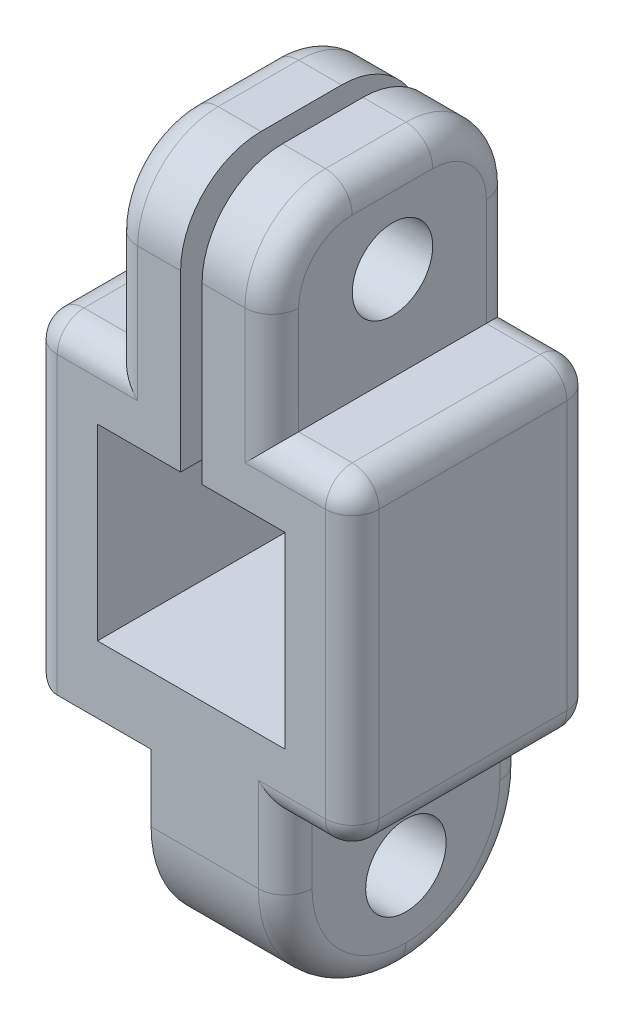
from build123d import *

# Parameters (mm, degrees)
SKETCH_1_W          = 3
SKETCH_1_H          = 7
SKETCH_1_W_2        = 12
SKETCH_1_H_2        = 12
SKETCH_1_W_3        = 7
SKETCH_1_W_4        = 5
EXTRUDE_1_DEPTH     = 9
CUT_EXTRUDE_1_DEPTH = 17.911534525
FILLET_1_R          = 4.5
SKETCH_3_R          = 1.5
CUT_EXTRUDE_2_DEPTH = 19.445866746
FILLET_2_R          = 3
SKETCH_4_R          = 1.5
CUT_EXTRUDE_3_DEPTH = 19.193405399
FILLET_3_R          = 1
FILLET_4_R          = 1
FILLET_5_R          = 1
FILLET_6_R          = 1


# Some blends are built 0.0001 mm under size
with BuildPart() as part:
    # 草图1 → 凸台-拉伸1 (new body)
    # profile 1 of 4: a face of its own
    with BuildSketch(Plane.XY):
        with Locations((-1.5, 9.5)):
            Rectangle(SKETCH_1_W, SKETCH_1_H)
    # profile 2 of 4: a face of its own
    with BuildSketch(Plane.XY):
        with Locations((1.5, 9.5)):
            Rectangle(SKETCH_1_W, SKETCH_1_H)
    # profile 3 of 4: a face of its own
    with BuildSketch(Plane.XY):
        Rectangle(SKETCH_1_W_2, SKETCH_1_H_2)
        Rectangle(SKETCH_1_W_3, SKETCH_1_H, mode=Mode.SUBTRACT)
    # profile 4 of 4: a face of its own
    with BuildSketch(Plane.XY):
        with Locations((1, -9.5)):
            Rectangle(SKETCH_1_W_4, SKETCH_1_H)
    extrude(amount=EXTRUDE_1_DEPTH)

    # 草图2 → 切除-拉伸1 (cut, through all)
    with BuildSketch(Plane.XY.offset(9)):
        Polygon((0, 13), (0.4, 13), (0.4, 3.5), (0, 3.5), (-0.4, 3.5), (-0.4, 13), align=None)
    extrude(amount=-CUT_EXTRUDE_1_DEPTH, mode=Mode.SUBTRACT)

    # 圆角1
    fillet_1_edges = [part.edges().sort_by_distance(p)[0] for p in [
        (1, -13, 0),
        (1, -13, 9),
    ]]
    fillet(fillet_1_edges, radius=FILLET_1_R - 0.0001)  # a hair under: the kernel refuses the full size

    # 草图3 → 切除-拉伸2 (cut, through all)
    with BuildSketch(Plane(origin=(3.5, 0, 0), x_dir=(0, 0, -1), z_dir=(1, 0, 0))):
        with Locations(Location((-4.5, -9.5, 0), (0, 0, 90))):
            Circle(SKETCH_3_R)
    extrude(amount=-CUT_EXTRUDE_2_DEPTH, mode=Mode.SUBTRACT)

    # 圆角2
    fillet_2_edges = [part.edges().sort_by_distance(p)[0] for p in [
        (1.7, 13, 9),
        (1.7, 13, 0),
        (-1.7, 13, 0),
        (-1.7, 13, 9),
    ]]
    fillet(fillet_2_edges, radius=FILLET_2_R)

    # 草图4 → 切除-拉伸3 (cut, through all)
    with BuildSketch(Plane(origin=(3, 0, 0), x_dir=(0, 0, -1), z_dir=(1, 0, 0))):
        with Locations((-4.5, 9.5)):
            Circle(SKETCH_4_R)
    extrude(amount=-CUT_EXTRUDE_3_DEPTH, mode=Mode.SUBTRACT)

    # 圆角3
    fillet_3_edges = [part.edges().sort_by_distance(p)[0] for p in [
        (3, 12.121320344, 8.121320344),
        (3, 12.121320344, 0.878679656),
        (3, 8, 9),
        (6, 0, 0),
        (3, 8, 0),
        (4.5, 6, 0),
        (6, 6, 4.5),
        (6, -6, 4.5),
        (4.5, 6, 9),
        (6, 0, 9),
        (3, 13, 4.5),
    ]]
    fillet(fillet_3_edges, radius=FILLET_3_R)

    # 圆角4
    fillet_4_edges = [part.edges().sort_by_distance(p)[0] for p in [
        (-3, 13, 4.5),
        (-3, 12.121320344, 8.121320344),
        (-3, 12.121320344, 0.878679656),
        (-3, 8, 9),
        (-6, 0, 0),
        (-4.5, 6, 0),
        (-3, 8, 0),
        (-4.5, 6, 9),
        (-6, 0, 9),
        (-6, -6, 4.5),
    ]]
    fillet(fillet_4_edges, radius=FILLET_4_R)

    # 圆角5
    # the kernel refuses this fillet: 1 mm, written as the material it takes off along each edge
    with BuildSketch(Plane(origin=(-5, 5, 8), x_dir=(0, 1, 0), z_dir=(-1, 0, 0))) as fillet_5_piece_1_section:
        Polygon((0, 0), (FILLET_5_R, 0), (FILLET_5_R, -FILLET_5_R), (0, -FILLET_5_R), align=None)
    fillet_5_piece_1 = extrude(amount=FILLET_5_R, mode=Mode.PRIVATE)
    fillet_5_piece_1 = fillet_5_piece_1 - Plane(origin=(-5, 5, 8), x_dir=(0, -0.7071067811865475, -0.7071067811865475), z_dir=(-1, 0, 0)) * Sphere(FILLET_5_R, mode=Mode.PRIVATE)
    add(fillet_5_piece_1, mode=Mode.SUBTRACT)
    with BuildSketch(Plane(origin=(-5, 5, 1), x_dir=(0, 1, 0), z_dir=(-1, 0, 0))) as fillet_5_piece_2_section:
        Polygon((0, 0), (FILLET_5_R, 0), (FILLET_5_R, FILLET_5_R), (0, FILLET_5_R), align=None)
    fillet_5_piece_2 = extrude(amount=FILLET_5_R, mode=Mode.PRIVATE)
    fillet_5_piece_2 = fillet_5_piece_2 - Plane(origin=(-5, 5, 1), x_dir=(0, -0.7071067811865475, 0.7071067811865475), z_dir=(-1, 0, 0)) * Sphere(FILLET_5_R, mode=Mode.PRIVATE)
    add(fillet_5_piece_2, mode=Mode.SUBTRACT)
    with BuildSketch(Plane(origin=(-6, 6, 1), x_dir=(0, -1, 0), z_dir=(0, 0, 1))) as fillet_5_piece_3:
        with BuildLine():
            CenterArc((FILLET_5_R, FILLET_5_R), FILLET_5_R, 180, 90)
            Line((0, FILLET_5_R), (0, 0))
            Line((0, 0), (FILLET_5_R, 0))
        make_face()
    extrude(amount=7, mode=Mode.SUBTRACT)

    # 圆角6
    # the kernel refuses this fillet: 1 mm, written as the material it takes off along each edge
    with BuildSketch(Plane(origin=(5, -5, 8), x_dir=(0, 0, 1), z_dir=(0, -1, 0))) as fillet_6_piece_1_section:
        Polygon((0, 0), (FILLET_6_R, 0), (FILLET_6_R, -FILLET_6_R), (0, -FILLET_6_R), align=None)
    fillet_6_piece_1 = extrude(amount=FILLET_6_R, mode=Mode.PRIVATE)
    fillet_6_piece_1 = fillet_6_piece_1 - Plane(origin=(5, -5, 8), x_dir=(-0.7071067811865475, 0, -0.7071067811865475), z_dir=(0, -1, 0)) * Sphere(FILLET_6_R, mode=Mode.PRIVATE)
    add(fillet_6_piece_1, mode=Mode.SUBTRACT)
    with BuildSketch(Plane(origin=(5, -5, 1), x_dir=(0, -1, 0), z_dir=(0, 0, -1))) as fillet_6_piece_2_section:
        Polygon((0, 0), (FILLET_6_R, 0), (FILLET_6_R, -FILLET_6_R), (0, -FILLET_6_R), align=None)
    fillet_6_piece_2 = extrude(amount=FILLET_6_R, mode=Mode.PRIVATE)
    fillet_6_piece_2 = fillet_6_piece_2 - Plane(origin=(5, -5, 1), x_dir=(-0.7071067811865476, 0.7071067811865475, 0), z_dir=(0, 0, -1)) * Sphere(FILLET_6_R, mode=Mode.PRIVATE)
    add(fillet_6_piece_2, mode=Mode.SUBTRACT)
    with BuildSketch(Plane(origin=(5, -6, 0), x_dir=(0, 1, 0), z_dir=(-1, 0, 0)), Plane(origin=(5, -6, 9), x_dir=(0, 0, -1), z_dir=(-1, 0, 0))) as fillet_6_piece_3:
        with BuildLine():
            CenterArc((FILLET_6_R, -FILLET_6_R), FILLET_6_R, 90, 90)
            Line((0, -FILLET_6_R), (0, 0))
            Line((0, 0), (FILLET_6_R, 0))
        make_face()
    extrude(amount=1.5, mode=Mode.SUBTRACT)
    with BuildSketch(Plane(origin=(3.5, -8.5001, 0), x_dir=(-1, 0, 0), z_dir=(0, 1, 0)), Plane(origin=(3.5, -8.5001, 9), x_dir=(0, 0, -1), z_dir=(0, 1, 0))) as fillet_6_piece_4:
        with BuildLine():
            CenterArc((FILLET_6_R, FILLET_6_R), FILLET_6_R, 180, 90)
            Line((0, FILLET_6_R), (0, 0))
            Line((0, 0), (FILLET_6_R, 0))
        make_face()
    extrude(amount=2.5001, mode=Mode.SUBTRACT)
    with BuildSketch(Plane(origin=(3.5, -8.5001, 4.5001), x_dir=(0, 0, 1), z_dir=(0, 1, 0))) as fillet_6_piece_5:
        with BuildLine():
            CenterArc((4.4999 - FILLET_6_R, -FILLET_6_R), FILLET_6_R, 0, 90)
            Line((4.4999, -FILLET_6_R), (4.4999, 0))
            Line((4.4999, 0), (4.4999 - FILLET_6_R, 0))
        make_face()
    revolve(axis=Axis((3.5, -8.5001, 4.5001), (1, 0, 0)), revolution_arc=90, mode=Mode.SUBTRACT)
    with BuildSketch(Plane(origin=(3.5, -8.5001, 4.4999), x_dir=(0, 0, -1), z_dir=(0, 1, 0))) as fillet_6_piece_6:
        with BuildLine():
            CenterArc((4.4999 - FILLET_6_R, FILLET_6_R), FILLET_6_R, 270, 90)
            Line((4.4999 - FILLET_6_R, 0), (4.4999, 0))
            Line((4.4999, 0), (4.4999, FILLET_6_R))
        make_face()
    revolve(axis=Axis((3.5, -8.5001, 4.4999), (-1, 0, 0)), revolution_arc=90, mode=Mode.SUBTRACT)
    with BuildSketch(Plane(origin=(3.5, -13, 4.4999), x_dir=(0, 1, 0), z_dir=(0, 0, 1))) as fillet_6_piece_7:
        with BuildLine():
            CenterArc((FILLET_6_R, FILLET_6_R), FILLET_6_R, 180, 90)
            Line((0, FILLET_6_R), (0, 0))
            Line((0, 0), (FILLET_6_R, 0))
        make_face()
    extrude(amount=0.0002, mode=Mode.SUBTRACT)
    with BuildSketch(Plane(origin=(3.5, -8.5001, 0), x_dir=(-1, 0, 0), z_dir=(0, 1, 0))) as fillet_6_piece_8a_section:
        with BuildLine():
            CenterArc((FILLET_6_R, FILLET_6_R), FILLET_6_R, 180, 90)
            Line((0, FILLET_6_R), (0, 0))
            Line((0, 0), (FILLET_6_R, 0))
        make_face()
    fillet_6_piece_8a = extrude(amount=5.0001, mode=Mode.PRIVATE)
    fillet_6_piece_8a = split(fillet_6_piece_8a, bisect_by=Plane(origin=(3.273604886, -6, 0.226395114), z_dir=(0, 1, 0)), keep=Keep.TOP, mode=Mode.PRIVATE)
    with BuildSketch(Plane(origin=(5, -6, 0), x_dir=(0, 1, 0), z_dir=(-1, 0, 0))) as fillet_6_piece_8b_section:
        with BuildLine():
            CenterArc((FILLET_6_R, -FILLET_6_R), FILLET_6_R, 90, 90)
            Line((0, -FILLET_6_R), (0, 0))
            Line((0, 0), (FILLET_6_R, 0))
        make_face()
    fillet_6_piece_8b = extrude(amount=4, mode=Mode.PRIVATE)
    fillet_6_piece_8b = split(fillet_6_piece_8b, bisect_by=Plane(origin=(3.5, -5.773604886, 0.226395114), z_dir=(-1, 0, 0)), keep=Keep.TOP, mode=Mode.PRIVATE)
    fillet_6_piece_8 = fillet_6_piece_8a & fillet_6_piece_8b
    add(fillet_6_piece_8, mode=Mode.SUBTRACT)
    with BuildSketch(Plane(origin=(3.5, -8.5001, 9), x_dir=(0, 0, -1), z_dir=(0, 1, 0))) as fillet_6_piece_9a_section:
        with BuildLine():
            CenterArc((FILLET_6_R, FILLET_6_R), FILLET_6_R, 180, 90)
            Line((0, FILLET_6_R), (0, 0))
            Line((0, 0), (FILLET_6_R, 0))
        make_face()
    fillet_6_piece_9a = extrude(amount=5.0001, mode=Mode.PRIVATE)
    fillet_6_piece_9a = split(fillet_6_piece_9a, bisect_by=Plane(origin=(3.273604886, -6, 8.773604886), z_dir=(0, 1, 0)), keep=Keep.TOP, mode=Mode.PRIVATE)
    with BuildSketch(Plane(origin=(5, -6, 9), x_dir=(0, 0, -1), z_dir=(-1, 0, 0))) as fillet_6_piece_9b_section:
        with BuildLine():
            CenterArc((FILLET_6_R, -FILLET_6_R), FILLET_6_R, 90, 90)
            Line((0, -FILLET_6_R), (0, 0))
            Line((0, 0), (FILLET_6_R, 0))
        make_face()
    fillet_6_piece_9b = extrude(amount=4, mode=Mode.PRIVATE)
    fillet_6_piece_9b = split(fillet_6_piece_9b, bisect_by=Plane(origin=(3.5, -5.773604886, 8.773604886), z_dir=(-1, 0, 0)), keep=Keep.TOP, mode=Mode.PRIVATE)
    fillet_6_piece_9 = fillet_6_piece_9a & fillet_6_piece_9b
    add(fillet_6_piece_9, mode=Mode.SUBTRACT)


solid = part.part
